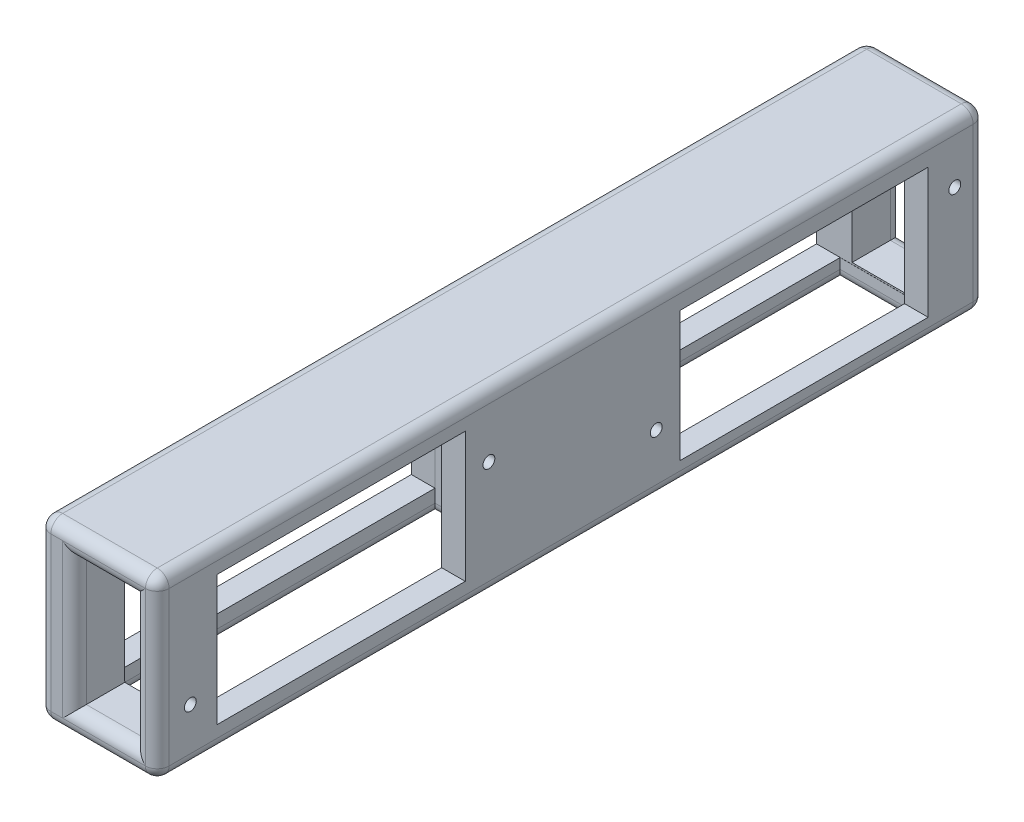
from build123d import *

# Parameters (mm, degrees)
ESQUISSE1_W             = 140
ESQUISSE1_H             = 30
BOSS_EXTRU_1_DEPTH      = 20
ESQUISSE2_R             = 1
ENL_V_MAT_EXTRU_1_DEPTH = 10
ESQUISSE4_R             = 1
ENL_V_MAT_EXTRU_2_DEPTH = 10
ESQUISSE5_W             = 10
ESQUISSE5_H             = 22
ENL_V_MAT_EXTRU_3_DEPTH = 63
ESQUISSE6_W             = 10
ESQUISSE6_H             = 22
ENL_V_MAT_EXTRU_4_DEPTH = 63
ENL_V_MAT_EXTRU_5_REACH = 83.358
ESQUISSE7_W             = 12
ESQUISSE7_H             = 54.5
ENL_V_MAT_EXTRU_6_REACH = 83.358
ESQUISSE8_W             = 12
ESQUISSE8_H             = 54.5
CONG_1_R                = 2
ESQUISSE9_W             = 54.518801533
ESQUISSE9_H             = 21.792349727
ENL_V_MAT_EXTRU_7_DEPTH = 79.996266608
ESQUISSE11_W            = 54.518801533
ESQUISSE11_H            = 21.792349727
ENL_V_MAT_EXTRU_8_DEPTH = 79.996266608


with BuildPart() as part:
    # Esquisse1 → Boss.-Extru.1 (new body)
    with BuildSketch(Plane(origin=(0, 0, 0), x_dir=(0, 0, -1), z_dir=(1, 0, 0))):
        with Locations((2.932604736, 10.792349727)):
            Rectangle(ESQUISSE1_W, ESQUISSE1_H)
    extrude(amount=BOSS_EXTRU_1_DEPTH)

    # Esquisse2 → Enlèv. mat.-Extru.1 (cut)
    with BuildSketch(Plane(origin=(20, 0, 0), x_dir=(0, 0, -1), z_dir=(1, 0, 0))):
        with Locations((67.832604736, 16.118903051)):
            Circle(ESQUISSE2_R)
        with Locations((17.332604736, 5.818903051)):
            Circle(ESQUISSE2_R)
        Polygon((63.332604736, -0.681096949), (21.332604736, -0.681096949), (21.332604736, 21.318903051), (63.332604736, 21.318903051), (63.332604736, 12.318903051), (63.332604736, 8.068903051), align=None)
    extrude(amount=-ENL_V_MAT_EXTRU_1_DEPTH, mode=Mode.SUBTRACT)

    # Esquisse4 → Enlèv. mat.-Extru.2 (cut)
    with BuildSketch(Plane(origin=(20, 26.612998823, 128.329870586), x_dir=(0, 0, 1), z_dir=(1, 0, 0))):
        with Locations(Location((-117.356713594, 11.320649096, 0), (0, 0, 180))):
            Circle(ESQUISSE4_R)
        with Locations(Location((-66.856713594, 21.620649096, 0), (0, 0, 180))):
            Circle(ESQUISSE4_R)
        Polygon((-113.356713594, 26.820649096), (-113.356713594, 4.820649096), (-71.356713594, 4.820649096), (-71.356713594, 13.570649096), (-71.356713594, 18.070649096), (-71.356713594, 26.820649096), align=None)
    extrude(amount=-ENL_V_MAT_EXTRU_2_DEPTH, mode=Mode.SUBTRACT)

    # Esquisse5 → Enlèv. mat.-Extru.3 (cut)
    with BuildSketch(Plane.XY.offset(67.067395264)):
        with Locations((11, 10.792349727)):
            Rectangle(ESQUISSE5_W, ESQUISSE5_H)
    extrude(amount=-ENL_V_MAT_EXTRU_3_DEPTH, mode=Mode.SUBTRACT)

    # Esquisse6 → Enlèv. mat.-Extru.4 (cut)
    with BuildSketch(Plane(origin=(0, 0, -72.932604736), x_dir=(-1, 0, 0), z_dir=(0, 0, -1))):
        with Locations((-11, 10.792349727)):
            Rectangle(ESQUISSE6_W, ESQUISSE6_H)
    extrude(amount=-ENL_V_MAT_EXTRU_4_DEPTH, mode=Mode.SUBTRACT)

    # Enlèv. mat.-Extru.5: up to this face of the body (flat: up to its plane)
    enl_v_mat_extru_5_end = Plane(part.part.faces().sort_by_distance((11, 21.792349727, -41.432604736))[0])
    # Esquisse7 → Enlèv. mat.-Extru.5 (cut, up to the picked face)
    with BuildSketch(Plane.XZ.offset(4.207650273), mode=Mode.PRIVATE) as enl_v_mat_extru_5_sk1:
        with Locations((10, -37.182604736)):
            Rectangle(ESQUISSE7_W, ESQUISSE7_H)
    enl_v_mat_extru_5_tool1 = split(extrude(enl_v_mat_extru_5_sk1.sketch, amount=-ENL_V_MAT_EXTRU_5_REACH, mode=Mode.PRIVATE), bisect_by=enl_v_mat_extru_5_end, keep=Keep.BOTH, mode=Mode.PRIVATE)
    add(enl_v_mat_extru_5_tool1.solids().sort_by(Axis((10, -4.20765, -37.182605), (0, 1, 0)))[0], mode=Mode.SUBTRACT)

    # Enlèv. mat.-Extru.6: up to this face of the body (flat: up to its plane)
    enl_v_mat_extru_6_end = Plane(part.part.faces().sort_by_distance((12.473684211, 21.792349727, 35.652818786))[0])
    # Esquisse8 → Enlèv. mat.-Extru.6 (cut, up to the picked face)
    with BuildSketch(Plane(origin=(0, -4.207650273, 0), x_dir=(-1, 0, 0), z_dir=(0, -1, 0)), mode=Mode.PRIVATE) as enl_v_mat_extru_6_sk1:
        with Locations((-10, -31.317395264)):
            Rectangle(ESQUISSE8_W, ESQUISSE8_H)
    enl_v_mat_extru_6_tool1 = split(extrude(enl_v_mat_extru_6_sk1.sketch, amount=-ENL_V_MAT_EXTRU_6_REACH, mode=Mode.PRIVATE), bisect_by=enl_v_mat_extru_6_end, keep=Keep.BOTH, mode=Mode.PRIVATE)
    add(enl_v_mat_extru_6_tool1.solids().sort_by(Axis((10, -4.20765, 31.317395), (0, 1, 0)))[0], mode=Mode.SUBTRACT)

    # Congé1
    cong_1_edges = [part.edges().sort_by_distance(p)[0] for p in [
        (4, -4.207650273, -37.182604736),
        (10, -4.207650273, -64.432604736),
        (16, -4.207650273, -37.182604736),
        (10, -4.207650273, -9.932604736),
        (20, 10.792349727, -72.932604736),
        (4, -4.207650273, 31.317395264),
        (10, -4.207650273, 4.067395264),
        (16, -4.207650273, 31.317395264),
        (10, -4.207650273, 58.567395264),
        (20, 25.792349727, -2.932604736),
        (20, 10.792349727, 67.067395264),
        (0, 25.792349727, -2.932604736),
        (0, 10.792349727, -72.932604736),
        (0, -4.207650273, -2.932604736),
        (0, 10.792349727, 67.067395264),
        (11, 21.792349727, 67.067395264),
        (6, 10.792349727, 67.067395264),
        (11, -0.207650273, 67.067395264),
        (16, 10.792349727, 67.067395264),
        (10, 25.792349727, 67.067395264),
        (10, 25.792349727, -72.932604736),
        (10, -4.207650273, -72.932604736),
        (10, -4.207650273, 67.067395264),
        (20, -4.207650273, -2.932604736),
        (11, 21.792349727, -72.932604736),
        (16, 10.792349727, -72.932604736),
        (11, -0.207650273, -72.932604736),
        (6, 10.792349727, -72.932604736),
    ]]
    fillet(cong_1_edges, radius=CONG_1_R - 0.0001)  # a hair under: the kernel refuses the full size

    # Esquisse9 → Enlèv. mat.-Extru.7 (cut, through all)
    with BuildSketch(Plane.ZY.offset(-16)):
        with Locations((31.349786376, 10.896174864)):
            Rectangle(ESQUISSE9_W, ESQUISSE9_H)
    extrude(amount=ENL_V_MAT_EXTRU_7_DEPTH, mode=Mode.SUBTRACT)

    # Esquisse11 → Enlèv. mat.-Extru.8 (cut, through all)
    with BuildSketch(Plane.ZY.offset(-16)):
        with Locations((-37.192905042, 10.412626725)):
            Rectangle(ESQUISSE11_W, ESQUISSE11_H)
    extrude(amount=ENL_V_MAT_EXTRU_8_DEPTH, mode=Mode.SUBTRACT)


solid = part.part
